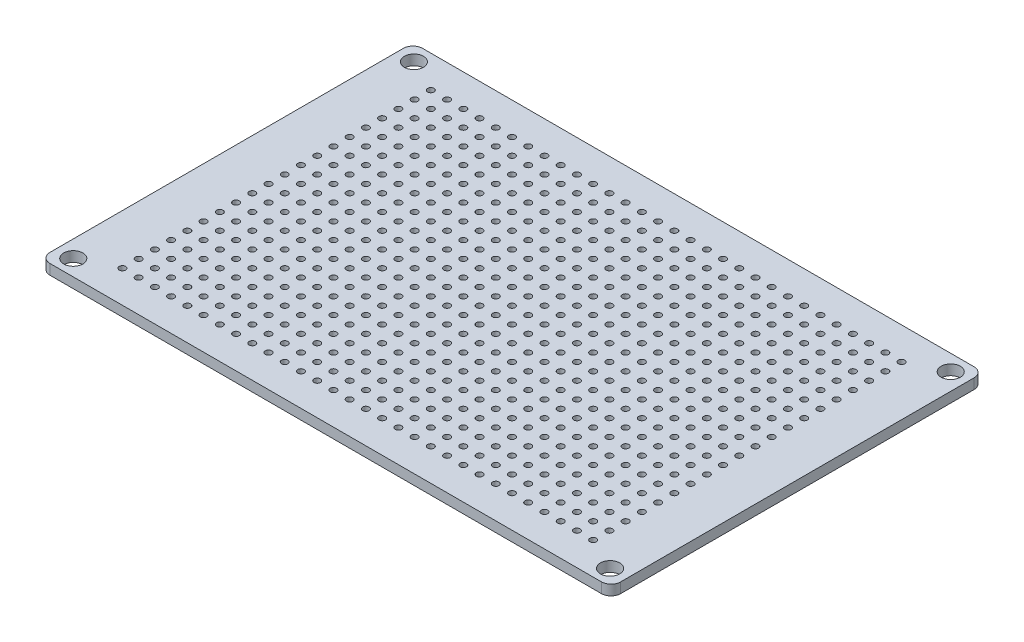
from build123d import *

# Parameters (mm, degrees)
SKETCH1_R           = 0.5
SKETCH1_R_2         = 1.5
BOSS_EXTRUDE1_DEPTH = 1.6


with BuildPart() as part:
    # Sketch1 → Boss-Extrude1 (new body)
    with BuildSketch(Plane(origin=(0, 0, 0), x_dir=(1, 0, 0), z_dir=(0, 1, 0))):
        with BuildLine():
            Line((1.5, 0), (87.8, 0))
            ThreePointArc((87.8, 0), (88.860660172, -0.439339828), (89.3, -1.5))
            Line((89.3, -1.5), (89.3, -56.8))
            ThreePointArc((89.3, -56.8), (88.860660172, -57.860660172), (87.8, -58.3))
            Line((87.8, -58.3), (1.5, -58.3))
            ThreePointArc((1.5, -58.3), (0.439339828, -57.860660172), (0, -56.8))
            Line((0, -56.8), (0, -1.5))
            ThreePointArc((0, -1.5), (0.439339828, -0.439339828), (1.5, 0))
        make_face()
        with Locations((7.82, -5.02)):
            Circle(SKETCH1_R, mode=Mode.SUBTRACT)
        with Locations((10.36, -5.02)):
            Circle(SKETCH1_R, mode=Mode.SUBTRACT)
        with Locations((12.9, -5.02)):
            Circle(SKETCH1_R, mode=Mode.SUBTRACT)
        with Locations((15.44, -5.02)):
            Circle(SKETCH1_R, mode=Mode.SUBTRACT)
        with Locations((17.98, -5.02)):
            Circle(SKETCH1_R, mode=Mode.SUBTRACT)
        with Locations((20.52, -5.02)):
            Circle(SKETCH1_R, mode=Mode.SUBTRACT)
        with Locations((23.06, -5.02)):
            Circle(SKETCH1_R, mode=Mode.SUBTRACT)
        with Locations((25.6, -5.02)):
            Circle(SKETCH1_R, mode=Mode.SUBTRACT)
        with Locations((28.14, -5.02)):
            Circle(SKETCH1_R, mode=Mode.SUBTRACT)
        with Locations((30.68, -5.02)):
            Circle(SKETCH1_R, mode=Mode.SUBTRACT)
        with Locations((33.22, -5.02)):
            Circle(SKETCH1_R, mode=Mode.SUBTRACT)
        with Locations((35.76, -5.02)):
            Circle(SKETCH1_R, mode=Mode.SUBTRACT)
        with Locations((38.3, -5.02)):
            Circle(SKETCH1_R, mode=Mode.SUBTRACT)
        with Locations((40.84, -5.02)):
            Circle(SKETCH1_R, mode=Mode.SUBTRACT)
        with Locations((43.38, -5.02)):
            Circle(SKETCH1_R, mode=Mode.SUBTRACT)
        with Locations((45.92, -5.02)):
            Circle(SKETCH1_R, mode=Mode.SUBTRACT)
        with Locations((48.46, -5.02)):
            Circle(SKETCH1_R, mode=Mode.SUBTRACT)
        with Locations((51, -5.02)):
            Circle(SKETCH1_R, mode=Mode.SUBTRACT)
        with Locations((53.54, -5.02)):
            Circle(SKETCH1_R, mode=Mode.SUBTRACT)
        with Locations((56.08, -5.02)):
            Circle(SKETCH1_R, mode=Mode.SUBTRACT)
        with Locations((58.62, -5.02)):
            Circle(SKETCH1_R, mode=Mode.SUBTRACT)
        with Locations((61.16, -5.02)):
            Circle(SKETCH1_R, mode=Mode.SUBTRACT)
        with Locations((63.7, -5.02)):
            Circle(SKETCH1_R, mode=Mode.SUBTRACT)
        with Locations((66.24, -5.02)):
            Circle(SKETCH1_R, mode=Mode.SUBTRACT)
        with Locations((68.78, -5.02)):
            Circle(SKETCH1_R, mode=Mode.SUBTRACT)
        with Locations((71.32, -5.02)):
            Circle(SKETCH1_R, mode=Mode.SUBTRACT)
        with Locations((73.86, -5.02)):
            Circle(SKETCH1_R, mode=Mode.SUBTRACT)
        with Locations((76.4, -5.02)):
            Circle(SKETCH1_R, mode=Mode.SUBTRACT)
        with Locations((78.94, -5.02)):
            Circle(SKETCH1_R, mode=Mode.SUBTRACT)
        with Locations((81.48, -5.02)):
            Circle(SKETCH1_R, mode=Mode.SUBTRACT)
        with Locations((10.36, -7.56)):
            Circle(SKETCH1_R, mode=Mode.SUBTRACT)
        with Locations((12.9, -7.56)):
            Circle(SKETCH1_R, mode=Mode.SUBTRACT)
        with Locations((15.44, -7.56)):
            Circle(SKETCH1_R, mode=Mode.SUBTRACT)
        with Locations((17.98, -7.56)):
            Circle(SKETCH1_R, mode=Mode.SUBTRACT)
        with Locations((20.52, -7.56)):
            Circle(SKETCH1_R, mode=Mode.SUBTRACT)
        with Locations((23.06, -7.56)):
            Circle(SKETCH1_R, mode=Mode.SUBTRACT)
        with Locations((25.6, -7.56)):
            Circle(SKETCH1_R, mode=Mode.SUBTRACT)
        with Locations((28.14, -7.56)):
            Circle(SKETCH1_R, mode=Mode.SUBTRACT)
        with Locations((30.68, -7.56)):
            Circle(SKETCH1_R, mode=Mode.SUBTRACT)
        with Locations((33.22, -7.56)):
            Circle(SKETCH1_R, mode=Mode.SUBTRACT)
        with Locations((35.76, -7.56)):
            Circle(SKETCH1_R, mode=Mode.SUBTRACT)
        with Locations((38.3, -7.56)):
            Circle(SKETCH1_R, mode=Mode.SUBTRACT)
        with Locations((40.84, -7.56)):
            Circle(SKETCH1_R, mode=Mode.SUBTRACT)
        with Locations((43.38, -7.56)):
            Circle(SKETCH1_R, mode=Mode.SUBTRACT)
        with Locations((45.92, -7.56)):
            Circle(SKETCH1_R, mode=Mode.SUBTRACT)
        with Locations((48.46, -7.56)):
            Circle(SKETCH1_R, mode=Mode.SUBTRACT)
        with Locations((51, -7.56)):
            Circle(SKETCH1_R, mode=Mode.SUBTRACT)
        with Locations((53.54, -7.56)):
            Circle(SKETCH1_R, mode=Mode.SUBTRACT)
        with Locations((56.08, -7.56)):
            Circle(SKETCH1_R, mode=Mode.SUBTRACT)
        with Locations((58.62, -7.56)):
            Circle(SKETCH1_R, mode=Mode.SUBTRACT)
        with Locations((61.16, -7.56)):
            Circle(SKETCH1_R, mode=Mode.SUBTRACT)
        with Locations((63.7, -7.56)):
            Circle(SKETCH1_R, mode=Mode.SUBTRACT)
        with Locations((66.24, -7.56)):
            Circle(SKETCH1_R, mode=Mode.SUBTRACT)
        with Locations((68.78, -7.56)):
            Circle(SKETCH1_R, mode=Mode.SUBTRACT)
        with Locations((71.32, -7.56)):
            Circle(SKETCH1_R, mode=Mode.SUBTRACT)
        with Locations((73.86, -7.56)):
            Circle(SKETCH1_R, mode=Mode.SUBTRACT)
        with Locations((76.4, -7.56)):
            Circle(SKETCH1_R, mode=Mode.SUBTRACT)
        with Locations((78.94, -7.56)):
            Circle(SKETCH1_R, mode=Mode.SUBTRACT)
        with Locations((81.48, -7.56)):
            Circle(SKETCH1_R, mode=Mode.SUBTRACT)
        with Locations((10.36, -10.1)):
            Circle(SKETCH1_R, mode=Mode.SUBTRACT)
        with Locations((12.9, -10.1)):
            Circle(SKETCH1_R, mode=Mode.SUBTRACT)
        with Locations((15.44, -10.1)):
            Circle(SKETCH1_R, mode=Mode.SUBTRACT)
        with Locations((17.98, -10.1)):
            Circle(SKETCH1_R, mode=Mode.SUBTRACT)
        with Locations((20.52, -10.1)):
            Circle(SKETCH1_R, mode=Mode.SUBTRACT)
        with Locations((23.06, -10.1)):
            Circle(SKETCH1_R, mode=Mode.SUBTRACT)
        with Locations((25.6, -10.1)):
            Circle(SKETCH1_R, mode=Mode.SUBTRACT)
        with Locations((28.14, -10.1)):
            Circle(SKETCH1_R, mode=Mode.SUBTRACT)
        with Locations((30.68, -10.1)):
            Circle(SKETCH1_R, mode=Mode.SUBTRACT)
        with Locations((33.22, -10.1)):
            Circle(SKETCH1_R, mode=Mode.SUBTRACT)
        with Locations((35.76, -10.1)):
            Circle(SKETCH1_R, mode=Mode.SUBTRACT)
        with Locations((38.3, -10.1)):
            Circle(SKETCH1_R, mode=Mode.SUBTRACT)
        with Locations((40.84, -10.1)):
            Circle(SKETCH1_R, mode=Mode.SUBTRACT)
        with Locations((43.38, -10.1)):
            Circle(SKETCH1_R, mode=Mode.SUBTRACT)
        with Locations((45.92, -10.1)):
            Circle(SKETCH1_R, mode=Mode.SUBTRACT)
        with Locations((48.46, -10.1)):
            Circle(SKETCH1_R, mode=Mode.SUBTRACT)
        with Locations((51, -10.1)):
            Circle(SKETCH1_R, mode=Mode.SUBTRACT)
        with Locations((53.54, -10.1)):
            Circle(SKETCH1_R, mode=Mode.SUBTRACT)
        with Locations((56.08, -10.1)):
            Circle(SKETCH1_R, mode=Mode.SUBTRACT)
        with Locations((58.62, -10.1)):
            Circle(SKETCH1_R, mode=Mode.SUBTRACT)
        with Locations((61.16, -10.1)):
            Circle(SKETCH1_R, mode=Mode.SUBTRACT)
        with Locations((63.7, -10.1)):
            Circle(SKETCH1_R, mode=Mode.SUBTRACT)
        with Locations((66.24, -10.1)):
            Circle(SKETCH1_R, mode=Mode.SUBTRACT)
        with Locations((68.78, -10.1)):
            Circle(SKETCH1_R, mode=Mode.SUBTRACT)
        with Locations((71.32, -10.1)):
            Circle(SKETCH1_R, mode=Mode.SUBTRACT)
        with Locations((73.86, -10.1)):
            Circle(SKETCH1_R, mode=Mode.SUBTRACT)
        with Locations((76.4, -10.1)):
            Circle(SKETCH1_R, mode=Mode.SUBTRACT)
        with Locations((78.94, -10.1)):
            Circle(SKETCH1_R, mode=Mode.SUBTRACT)
        with Locations((81.48, -10.1)):
            Circle(SKETCH1_R, mode=Mode.SUBTRACT)
        with Locations((10.36, -12.64)):
            Circle(SKETCH1_R, mode=Mode.SUBTRACT)
        with Locations((12.9, -12.64)):
            Circle(SKETCH1_R, mode=Mode.SUBTRACT)
        with Locations((15.44, -12.64)):
            Circle(SKETCH1_R, mode=Mode.SUBTRACT)
        with Locations((17.98, -12.64)):
            Circle(SKETCH1_R, mode=Mode.SUBTRACT)
        with Locations((20.52, -12.64)):
            Circle(SKETCH1_R, mode=Mode.SUBTRACT)
        with Locations((23.06, -12.64)):
            Circle(SKETCH1_R, mode=Mode.SUBTRACT)
        with Locations((25.6, -12.64)):
            Circle(SKETCH1_R, mode=Mode.SUBTRACT)
        with Locations((28.14, -12.64)):
            Circle(SKETCH1_R, mode=Mode.SUBTRACT)
        with Locations((30.68, -12.64)):
            Circle(SKETCH1_R, mode=Mode.SUBTRACT)
        with Locations((33.22, -12.64)):
            Circle(SKETCH1_R, mode=Mode.SUBTRACT)
        with Locations((35.76, -12.64)):
            Circle(SKETCH1_R, mode=Mode.SUBTRACT)
        with Locations((38.3, -12.64)):
            Circle(SKETCH1_R, mode=Mode.SUBTRACT)
        with Locations((40.84, -12.64)):
            Circle(SKETCH1_R, mode=Mode.SUBTRACT)
        with Locations((43.38, -12.64)):
            Circle(SKETCH1_R, mode=Mode.SUBTRACT)
        with Locations((45.92, -12.64)):
            Circle(SKETCH1_R, mode=Mode.SUBTRACT)
        with Locations((48.46, -12.64)):
            Circle(SKETCH1_R, mode=Mode.SUBTRACT)
        with Locations((51, -12.64)):
            Circle(SKETCH1_R, mode=Mode.SUBTRACT)
        with Locations((53.54, -12.64)):
            Circle(SKETCH1_R, mode=Mode.SUBTRACT)
        with Locations((56.08, -12.64)):
            Circle(SKETCH1_R, mode=Mode.SUBTRACT)
        with Locations((58.62, -12.64)):
            Circle(SKETCH1_R, mode=Mode.SUBTRACT)
        with Locations((61.16, -12.64)):
            Circle(SKETCH1_R, mode=Mode.SUBTRACT)
        with Locations((63.7, -12.64)):
            Circle(SKETCH1_R, mode=Mode.SUBTRACT)
        with Locations((66.24, -12.64)):
            Circle(SKETCH1_R, mode=Mode.SUBTRACT)
        with Locations((68.78, -12.64)):
            Circle(SKETCH1_R, mode=Mode.SUBTRACT)
        with Locations((71.32, -12.64)):
            Circle(SKETCH1_R, mode=Mode.SUBTRACT)
        with Locations((73.86, -12.64)):
            Circle(SKETCH1_R, mode=Mode.SUBTRACT)
        with Locations((76.4, -12.64)):
            Circle(SKETCH1_R, mode=Mode.SUBTRACT)
        with Locations((78.94, -12.64)):
            Circle(SKETCH1_R, mode=Mode.SUBTRACT)
        with Locations((81.48, -12.64)):
            Circle(SKETCH1_R, mode=Mode.SUBTRACT)
        with Locations((10.36, -15.18)):
            Circle(SKETCH1_R, mode=Mode.SUBTRACT)
        with Locations((12.9, -15.18)):
            Circle(SKETCH1_R, mode=Mode.SUBTRACT)
        with Locations((15.44, -15.18)):
            Circle(SKETCH1_R, mode=Mode.SUBTRACT)
        with Locations((17.98, -15.18)):
            Circle(SKETCH1_R, mode=Mode.SUBTRACT)
        with Locations((20.52, -15.18)):
            Circle(SKETCH1_R, mode=Mode.SUBTRACT)
        with Locations((23.06, -15.18)):
            Circle(SKETCH1_R, mode=Mode.SUBTRACT)
        with Locations((25.6, -15.18)):
            Circle(SKETCH1_R, mode=Mode.SUBTRACT)
        with Locations((28.14, -15.18)):
            Circle(SKETCH1_R, mode=Mode.SUBTRACT)
        with Locations((30.68, -15.18)):
            Circle(SKETCH1_R, mode=Mode.SUBTRACT)
        with Locations((33.22, -15.18)):
            Circle(SKETCH1_R, mode=Mode.SUBTRACT)
        with Locations((35.76, -15.18)):
            Circle(SKETCH1_R, mode=Mode.SUBTRACT)
        with Locations((38.3, -15.18)):
            Circle(SKETCH1_R, mode=Mode.SUBTRACT)
        with Locations((40.84, -15.18)):
            Circle(SKETCH1_R, mode=Mode.SUBTRACT)
        with Locations((43.38, -15.18)):
            Circle(SKETCH1_R, mode=Mode.SUBTRACT)
        with Locations((45.92, -15.18)):
            Circle(SKETCH1_R, mode=Mode.SUBTRACT)
        with Locations((48.46, -15.18)):
            Circle(SKETCH1_R, mode=Mode.SUBTRACT)
        with Locations((51, -15.18)):
            Circle(SKETCH1_R, mode=Mode.SUBTRACT)
        with Locations((53.54, -15.18)):
            Circle(SKETCH1_R, mode=Mode.SUBTRACT)
        with Locations((56.08, -15.18)):
            Circle(SKETCH1_R, mode=Mode.SUBTRACT)
        with Locations((58.62, -15.18)):
            Circle(SKETCH1_R, mode=Mode.SUBTRACT)
        with Locations((61.16, -15.18)):
            Circle(SKETCH1_R, mode=Mode.SUBTRACT)
        with Locations((63.7, -15.18)):
            Circle(SKETCH1_R, mode=Mode.SUBTRACT)
        with Locations((66.24, -15.18)):
            Circle(SKETCH1_R, mode=Mode.SUBTRACT)
        with Locations((68.78, -15.18)):
            Circle(SKETCH1_R, mode=Mode.SUBTRACT)
        with Locations((71.32, -15.18)):
            Circle(SKETCH1_R, mode=Mode.SUBTRACT)
        with Locations((73.86, -15.18)):
            Circle(SKETCH1_R, mode=Mode.SUBTRACT)
        with Locations((76.4, -15.18)):
            Circle(SKETCH1_R, mode=Mode.SUBTRACT)
        with Locations((78.94, -15.18)):
            Circle(SKETCH1_R, mode=Mode.SUBTRACT)
        with Locations((81.48, -15.18)):
            Circle(SKETCH1_R, mode=Mode.SUBTRACT)
        with Locations((10.36, -17.72)):
            Circle(SKETCH1_R, mode=Mode.SUBTRACT)
        with Locations((12.9, -17.72)):
            Circle(SKETCH1_R, mode=Mode.SUBTRACT)
        with Locations((15.44, -17.72)):
            Circle(SKETCH1_R, mode=Mode.SUBTRACT)
        with Locations((17.98, -17.72)):
            Circle(SKETCH1_R, mode=Mode.SUBTRACT)
        with Locations((20.52, -17.72)):
            Circle(SKETCH1_R, mode=Mode.SUBTRACT)
        with Locations((23.06, -17.72)):
            Circle(SKETCH1_R, mode=Mode.SUBTRACT)
        with Locations((25.6, -17.72)):
            Circle(SKETCH1_R, mode=Mode.SUBTRACT)
        with Locations((28.14, -17.72)):
            Circle(SKETCH1_R, mode=Mode.SUBTRACT)
        with Locations((30.68, -17.72)):
            Circle(SKETCH1_R, mode=Mode.SUBTRACT)
        with Locations((33.22, -17.72)):
            Circle(SKETCH1_R, mode=Mode.SUBTRACT)
        with Locations((35.76, -17.72)):
            Circle(SKETCH1_R, mode=Mode.SUBTRACT)
        with Locations((38.3, -17.72)):
            Circle(SKETCH1_R, mode=Mode.SUBTRACT)
        with Locations((40.84, -17.72)):
            Circle(SKETCH1_R, mode=Mode.SUBTRACT)
        with Locations((43.38, -17.72)):
            Circle(SKETCH1_R, mode=Mode.SUBTRACT)
        with Locations((45.92, -17.72)):
            Circle(SKETCH1_R, mode=Mode.SUBTRACT)
        with Locations((48.46, -17.72)):
            Circle(SKETCH1_R, mode=Mode.SUBTRACT)
        with Locations((51, -17.72)):
            Circle(SKETCH1_R, mode=Mode.SUBTRACT)
        with Locations((53.54, -17.72)):
            Circle(SKETCH1_R, mode=Mode.SUBTRACT)
        with Locations((56.08, -17.72)):
            Circle(SKETCH1_R, mode=Mode.SUBTRACT)
        with Locations((58.62, -17.72)):
            Circle(SKETCH1_R, mode=Mode.SUBTRACT)
        with Locations((61.16, -17.72)):
            Circle(SKETCH1_R, mode=Mode.SUBTRACT)
        with Locations((63.7, -17.72)):
            Circle(SKETCH1_R, mode=Mode.SUBTRACT)
        with Locations((66.24, -17.72)):
            Circle(SKETCH1_R, mode=Mode.SUBTRACT)
        with Locations((68.78, -17.72)):
            Circle(SKETCH1_R, mode=Mode.SUBTRACT)
        with Locations((71.32, -17.72)):
            Circle(SKETCH1_R, mode=Mode.SUBTRACT)
        with Locations((73.86, -17.72)):
            Circle(SKETCH1_R, mode=Mode.SUBTRACT)
        with Locations((76.4, -17.72)):
            Circle(SKETCH1_R, mode=Mode.SUBTRACT)
        with Locations((78.94, -17.72)):
            Circle(SKETCH1_R, mode=Mode.SUBTRACT)
        with Locations((81.48, -17.72)):
            Circle(SKETCH1_R, mode=Mode.SUBTRACT)
        with Locations((10.36, -20.26)):
            Circle(SKETCH1_R, mode=Mode.SUBTRACT)
        with Locations((12.9, -20.26)):
            Circle(SKETCH1_R, mode=Mode.SUBTRACT)
        with Locations((15.44, -20.26)):
            Circle(SKETCH1_R, mode=Mode.SUBTRACT)
        with Locations((17.98, -20.26)):
            Circle(SKETCH1_R, mode=Mode.SUBTRACT)
        with Locations((20.52, -20.26)):
            Circle(SKETCH1_R, mode=Mode.SUBTRACT)
        with Locations((23.06, -20.26)):
            Circle(SKETCH1_R, mode=Mode.SUBTRACT)
        with Locations((25.6, -20.26)):
            Circle(SKETCH1_R, mode=Mode.SUBTRACT)
        with Locations((28.14, -20.26)):
            Circle(SKETCH1_R, mode=Mode.SUBTRACT)
        with Locations((30.68, -20.26)):
            Circle(SKETCH1_R, mode=Mode.SUBTRACT)
        with Locations((33.22, -20.26)):
            Circle(SKETCH1_R, mode=Mode.SUBTRACT)
        with Locations((35.76, -20.26)):
            Circle(SKETCH1_R, mode=Mode.SUBTRACT)
        with Locations((38.3, -20.26)):
            Circle(SKETCH1_R, mode=Mode.SUBTRACT)
        with Locations((40.84, -20.26)):
            Circle(SKETCH1_R, mode=Mode.SUBTRACT)
        with Locations((43.38, -20.26)):
            Circle(SKETCH1_R, mode=Mode.SUBTRACT)
        with Locations((45.92, -20.26)):
            Circle(SKETCH1_R, mode=Mode.SUBTRACT)
        with Locations((48.46, -20.26)):
            Circle(SKETCH1_R, mode=Mode.SUBTRACT)
        with Locations((51, -20.26)):
            Circle(SKETCH1_R, mode=Mode.SUBTRACT)
        with Locations((53.54, -20.26)):
            Circle(SKETCH1_R, mode=Mode.SUBTRACT)
        with Locations((56.08, -20.26)):
            Circle(SKETCH1_R, mode=Mode.SUBTRACT)
        with Locations((58.62, -20.26)):
            Circle(SKETCH1_R, mode=Mode.SUBTRACT)
        with Locations((61.16, -20.26)):
            Circle(SKETCH1_R, mode=Mode.SUBTRACT)
        with Locations((63.7, -20.26)):
            Circle(SKETCH1_R, mode=Mode.SUBTRACT)
        with Locations((66.24, -20.26)):
            Circle(SKETCH1_R, mode=Mode.SUBTRACT)
        with Locations((68.78, -20.26)):
            Circle(SKETCH1_R, mode=Mode.SUBTRACT)
        with Locations((71.32, -20.26)):
            Circle(SKETCH1_R, mode=Mode.SUBTRACT)
        with Locations((73.86, -20.26)):
            Circle(SKETCH1_R, mode=Mode.SUBTRACT)
        with Locations((76.4, -20.26)):
            Circle(SKETCH1_R, mode=Mode.SUBTRACT)
        with Locations((78.94, -20.26)):
            Circle(SKETCH1_R, mode=Mode.SUBTRACT)
        with Locations((81.48, -20.26)):
            Circle(SKETCH1_R, mode=Mode.SUBTRACT)
        with Locations((10.36, -22.8)):
            Circle(SKETCH1_R, mode=Mode.SUBTRACT)
        with Locations((12.9, -22.8)):
            Circle(SKETCH1_R, mode=Mode.SUBTRACT)
        with Locations((15.44, -22.8)):
            Circle(SKETCH1_R, mode=Mode.SUBTRACT)
        with Locations((17.98, -22.8)):
            Circle(SKETCH1_R, mode=Mode.SUBTRACT)
        with Locations((20.52, -22.8)):
            Circle(SKETCH1_R, mode=Mode.SUBTRACT)
        with Locations((23.06, -22.8)):
            Circle(SKETCH1_R, mode=Mode.SUBTRACT)
        with Locations((25.6, -22.8)):
            Circle(SKETCH1_R, mode=Mode.SUBTRACT)
        with Locations((28.14, -22.8)):
            Circle(SKETCH1_R, mode=Mode.SUBTRACT)
        with Locations((30.68, -22.8)):
            Circle(SKETCH1_R, mode=Mode.SUBTRACT)
        with Locations((33.22, -22.8)):
            Circle(SKETCH1_R, mode=Mode.SUBTRACT)
        with Locations((35.76, -22.8)):
            Circle(SKETCH1_R, mode=Mode.SUBTRACT)
        with Locations((38.3, -22.8)):
            Circle(SKETCH1_R, mode=Mode.SUBTRACT)
        with Locations((40.84, -22.8)):
            Circle(SKETCH1_R, mode=Mode.SUBTRACT)
        with Locations((43.38, -22.8)):
            Circle(SKETCH1_R, mode=Mode.SUBTRACT)
        with Locations((45.92, -22.8)):
            Circle(SKETCH1_R, mode=Mode.SUBTRACT)
        with Locations((48.46, -22.8)):
            Circle(SKETCH1_R, mode=Mode.SUBTRACT)
        with Locations((51, -22.8)):
            Circle(SKETCH1_R, mode=Mode.SUBTRACT)
        with Locations((53.54, -22.8)):
            Circle(SKETCH1_R, mode=Mode.SUBTRACT)
        with Locations((56.08, -22.8)):
            Circle(SKETCH1_R, mode=Mode.SUBTRACT)
        with Locations((58.62, -22.8)):
            Circle(SKETCH1_R, mode=Mode.SUBTRACT)
        with Locations((61.16, -22.8)):
            Circle(SKETCH1_R, mode=Mode.SUBTRACT)
        with Locations((63.7, -22.8)):
            Circle(SKETCH1_R, mode=Mode.SUBTRACT)
        with Locations((66.24, -22.8)):
            Circle(SKETCH1_R, mode=Mode.SUBTRACT)
        with Locations((68.78, -22.8)):
            Circle(SKETCH1_R, mode=Mode.SUBTRACT)
        with Locations((71.32, -22.8)):
            Circle(SKETCH1_R, mode=Mode.SUBTRACT)
        with Locations((73.86, -22.8)):
            Circle(SKETCH1_R, mode=Mode.SUBTRACT)
        with Locations((76.4, -22.8)):
            Circle(SKETCH1_R, mode=Mode.SUBTRACT)
        with Locations((78.94, -22.8)):
            Circle(SKETCH1_R, mode=Mode.SUBTRACT)
        with Locations((81.48, -22.8)):
            Circle(SKETCH1_R, mode=Mode.SUBTRACT)
        with Locations((10.36, -25.34)):
            Circle(SKETCH1_R, mode=Mode.SUBTRACT)
        with Locations((12.9, -25.34)):
            Circle(SKETCH1_R, mode=Mode.SUBTRACT)
        with Locations((15.44, -25.34)):
            Circle(SKETCH1_R, mode=Mode.SUBTRACT)
        with Locations((17.98, -25.34)):
            Circle(SKETCH1_R, mode=Mode.SUBTRACT)
        with Locations((20.52, -25.34)):
            Circle(SKETCH1_R, mode=Mode.SUBTRACT)
        with Locations((23.06, -25.34)):
            Circle(SKETCH1_R, mode=Mode.SUBTRACT)
        with Locations((25.6, -25.34)):
            Circle(SKETCH1_R, mode=Mode.SUBTRACT)
        with Locations((28.14, -25.34)):
            Circle(SKETCH1_R, mode=Mode.SUBTRACT)
        with Locations((30.68, -25.34)):
            Circle(SKETCH1_R, mode=Mode.SUBTRACT)
        with Locations((33.22, -25.34)):
            Circle(SKETCH1_R, mode=Mode.SUBTRACT)
        with Locations((35.76, -25.34)):
            Circle(SKETCH1_R, mode=Mode.SUBTRACT)
        with Locations((38.3, -25.34)):
            Circle(SKETCH1_R, mode=Mode.SUBTRACT)
        with Locations((40.84, -25.34)):
            Circle(SKETCH1_R, mode=Mode.SUBTRACT)
        with Locations((43.38, -25.34)):
            Circle(SKETCH1_R, mode=Mode.SUBTRACT)
        with Locations((45.92, -25.34)):
            Circle(SKETCH1_R, mode=Mode.SUBTRACT)
        with Locations((48.46, -25.34)):
            Circle(SKETCH1_R, mode=Mode.SUBTRACT)
        with Locations((51, -25.34)):
            Circle(SKETCH1_R, mode=Mode.SUBTRACT)
        with Locations((53.54, -25.34)):
            Circle(SKETCH1_R, mode=Mode.SUBTRACT)
        with Locations((56.08, -25.34)):
            Circle(SKETCH1_R, mode=Mode.SUBTRACT)
        with Locations((58.62, -25.34)):
            Circle(SKETCH1_R, mode=Mode.SUBTRACT)
        with Locations((61.16, -25.34)):
            Circle(SKETCH1_R, mode=Mode.SUBTRACT)
        with Locations((63.7, -25.34)):
            Circle(SKETCH1_R, mode=Mode.SUBTRACT)
        with Locations((66.24, -25.34)):
            Circle(SKETCH1_R, mode=Mode.SUBTRACT)
        with Locations((68.78, -25.34)):
            Circle(SKETCH1_R, mode=Mode.SUBTRACT)
        with Locations((71.32, -25.34)):
            Circle(SKETCH1_R, mode=Mode.SUBTRACT)
        with Locations((73.86, -25.34)):
            Circle(SKETCH1_R, mode=Mode.SUBTRACT)
        with Locations((76.4, -25.34)):
            Circle(SKETCH1_R, mode=Mode.SUBTRACT)
        with Locations((78.94, -25.34)):
            Circle(SKETCH1_R, mode=Mode.SUBTRACT)
        with Locations((81.48, -25.34)):
            Circle(SKETCH1_R, mode=Mode.SUBTRACT)
        with Locations((10.36, -27.88)):
            Circle(SKETCH1_R, mode=Mode.SUBTRACT)
        with Locations((12.9, -27.88)):
            Circle(SKETCH1_R, mode=Mode.SUBTRACT)
        with Locations((15.44, -27.88)):
            Circle(SKETCH1_R, mode=Mode.SUBTRACT)
        with Locations((17.98, -27.88)):
            Circle(SKETCH1_R, mode=Mode.SUBTRACT)
        with Locations((20.52, -27.88)):
            Circle(SKETCH1_R, mode=Mode.SUBTRACT)
        with Locations((23.06, -27.88)):
            Circle(SKETCH1_R, mode=Mode.SUBTRACT)
        with Locations((25.6, -27.88)):
            Circle(SKETCH1_R, mode=Mode.SUBTRACT)
        with Locations((28.14, -27.88)):
            Circle(SKETCH1_R, mode=Mode.SUBTRACT)
        with Locations((30.68, -27.88)):
            Circle(SKETCH1_R, mode=Mode.SUBTRACT)
        with Locations((33.22, -27.88)):
            Circle(SKETCH1_R, mode=Mode.SUBTRACT)
        with Locations((35.76, -27.88)):
            Circle(SKETCH1_R, mode=Mode.SUBTRACT)
        with Locations((38.3, -27.88)):
            Circle(SKETCH1_R, mode=Mode.SUBTRACT)
        with Locations((40.84, -27.88)):
            Circle(SKETCH1_R, mode=Mode.SUBTRACT)
        with Locations((43.38, -27.88)):
            Circle(SKETCH1_R, mode=Mode.SUBTRACT)
        with Locations((45.92, -27.88)):
            Circle(SKETCH1_R, mode=Mode.SUBTRACT)
        with Locations((48.46, -27.88)):
            Circle(SKETCH1_R, mode=Mode.SUBTRACT)
        with Locations((51, -27.88)):
            Circle(SKETCH1_R, mode=Mode.SUBTRACT)
        with Locations((53.54, -27.88)):
            Circle(SKETCH1_R, mode=Mode.SUBTRACT)
        with Locations((56.08, -27.88)):
            Circle(SKETCH1_R, mode=Mode.SUBTRACT)
        with Locations((58.62, -27.88)):
            Circle(SKETCH1_R, mode=Mode.SUBTRACT)
        with Locations((61.16, -27.88)):
            Circle(SKETCH1_R, mode=Mode.SUBTRACT)
        with Locations((63.7, -27.88)):
            Circle(SKETCH1_R, mode=Mode.SUBTRACT)
        with Locations((66.24, -27.88)):
            Circle(SKETCH1_R, mode=Mode.SUBTRACT)
        with Locations((68.78, -27.88)):
            Circle(SKETCH1_R, mode=Mode.SUBTRACT)
        with Locations((71.32, -27.88)):
            Circle(SKETCH1_R, mode=Mode.SUBTRACT)
        with Locations((73.86, -27.88)):
            Circle(SKETCH1_R, mode=Mode.SUBTRACT)
        with Locations((76.4, -27.88)):
            Circle(SKETCH1_R, mode=Mode.SUBTRACT)
        with Locations((78.94, -27.88)):
            Circle(SKETCH1_R, mode=Mode.SUBTRACT)
        with Locations((81.48, -27.88)):
            Circle(SKETCH1_R, mode=Mode.SUBTRACT)
        with Locations((10.36, -30.42)):
            Circle(SKETCH1_R, mode=Mode.SUBTRACT)
        with Locations((12.9, -30.42)):
            Circle(SKETCH1_R, mode=Mode.SUBTRACT)
        with Locations((15.44, -30.42)):
            Circle(SKETCH1_R, mode=Mode.SUBTRACT)
        with Locations((17.98, -30.42)):
            Circle(SKETCH1_R, mode=Mode.SUBTRACT)
        with Locations((20.52, -30.42)):
            Circle(SKETCH1_R, mode=Mode.SUBTRACT)
        with Locations((23.06, -30.42)):
            Circle(SKETCH1_R, mode=Mode.SUBTRACT)
        with Locations((25.6, -30.42)):
            Circle(SKETCH1_R, mode=Mode.SUBTRACT)
        with Locations((28.14, -30.42)):
            Circle(SKETCH1_R, mode=Mode.SUBTRACT)
        with Locations((30.68, -30.42)):
            Circle(SKETCH1_R, mode=Mode.SUBTRACT)
        with Locations((33.22, -30.42)):
            Circle(SKETCH1_R, mode=Mode.SUBTRACT)
        with Locations((35.76, -30.42)):
            Circle(SKETCH1_R, mode=Mode.SUBTRACT)
        with Locations((38.3, -30.42)):
            Circle(SKETCH1_R, mode=Mode.SUBTRACT)
        with Locations((40.84, -30.42)):
            Circle(SKETCH1_R, mode=Mode.SUBTRACT)
        with Locations((43.38, -30.42)):
            Circle(SKETCH1_R, mode=Mode.SUBTRACT)
        with Locations((45.92, -30.42)):
            Circle(SKETCH1_R, mode=Mode.SUBTRACT)
        with Locations((48.46, -30.42)):
            Circle(SKETCH1_R, mode=Mode.SUBTRACT)
        with Locations((51, -30.42)):
            Circle(SKETCH1_R, mode=Mode.SUBTRACT)
        with Locations((53.54, -30.42)):
            Circle(SKETCH1_R, mode=Mode.SUBTRACT)
        with Locations((56.08, -30.42)):
            Circle(SKETCH1_R, mode=Mode.SUBTRACT)
        with Locations((58.62, -30.42)):
            Circle(SKETCH1_R, mode=Mode.SUBTRACT)
        with Locations((61.16, -30.42)):
            Circle(SKETCH1_R, mode=Mode.SUBTRACT)
        with Locations((63.7, -30.42)):
            Circle(SKETCH1_R, mode=Mode.SUBTRACT)
        with Locations((66.24, -30.42)):
            Circle(SKETCH1_R, mode=Mode.SUBTRACT)
        with Locations((68.78, -30.42)):
            Circle(SKETCH1_R, mode=Mode.SUBTRACT)
        with Locations((71.32, -30.42)):
            Circle(SKETCH1_R, mode=Mode.SUBTRACT)
        with Locations((73.86, -30.42)):
            Circle(SKETCH1_R, mode=Mode.SUBTRACT)
        with Locations((76.4, -30.42)):
            Circle(SKETCH1_R, mode=Mode.SUBTRACT)
        with Locations((78.94, -30.42)):
            Circle(SKETCH1_R, mode=Mode.SUBTRACT)
        with Locations((81.48, -30.42)):
            Circle(SKETCH1_R, mode=Mode.SUBTRACT)
        with Locations((10.36, -32.96)):
            Circle(SKETCH1_R, mode=Mode.SUBTRACT)
        with Locations((12.9, -32.96)):
            Circle(SKETCH1_R, mode=Mode.SUBTRACT)
        with Locations((15.44, -32.96)):
            Circle(SKETCH1_R, mode=Mode.SUBTRACT)
        with Locations((17.98, -32.96)):
            Circle(SKETCH1_R, mode=Mode.SUBTRACT)
        with Locations((20.52, -32.96)):
            Circle(SKETCH1_R, mode=Mode.SUBTRACT)
        with Locations((23.06, -32.96)):
            Circle(SKETCH1_R, mode=Mode.SUBTRACT)
        with Locations((25.6, -32.96)):
            Circle(SKETCH1_R, mode=Mode.SUBTRACT)
        with Locations((28.14, -32.96)):
            Circle(SKETCH1_R, mode=Mode.SUBTRACT)
        with Locations((30.68, -32.96)):
            Circle(SKETCH1_R, mode=Mode.SUBTRACT)
        with Locations((33.22, -32.96)):
            Circle(SKETCH1_R, mode=Mode.SUBTRACT)
        with Locations((35.76, -32.96)):
            Circle(SKETCH1_R, mode=Mode.SUBTRACT)
        with Locations((38.3, -32.96)):
            Circle(SKETCH1_R, mode=Mode.SUBTRACT)
        with Locations((40.84, -32.96)):
            Circle(SKETCH1_R, mode=Mode.SUBTRACT)
        with Locations((43.38, -32.96)):
            Circle(SKETCH1_R, mode=Mode.SUBTRACT)
        with Locations((45.92, -32.96)):
            Circle(SKETCH1_R, mode=Mode.SUBTRACT)
        with Locations((48.46, -32.96)):
            Circle(SKETCH1_R, mode=Mode.SUBTRACT)
        with Locations((51, -32.96)):
            Circle(SKETCH1_R, mode=Mode.SUBTRACT)
        with Locations((53.54, -32.96)):
            Circle(SKETCH1_R, mode=Mode.SUBTRACT)
        with Locations((56.08, -32.96)):
            Circle(SKETCH1_R, mode=Mode.SUBTRACT)
        with Locations((58.62, -32.96)):
            Circle(SKETCH1_R, mode=Mode.SUBTRACT)
        with Locations((61.16, -32.96)):
            Circle(SKETCH1_R, mode=Mode.SUBTRACT)
        with Locations((63.7, -32.96)):
            Circle(SKETCH1_R, mode=Mode.SUBTRACT)
        with Locations((66.24, -32.96)):
            Circle(SKETCH1_R, mode=Mode.SUBTRACT)
        with Locations((68.78, -32.96)):
            Circle(SKETCH1_R, mode=Mode.SUBTRACT)
        with Locations((71.32, -32.96)):
            Circle(SKETCH1_R, mode=Mode.SUBTRACT)
        with Locations((73.86, -32.96)):
            Circle(SKETCH1_R, mode=Mode.SUBTRACT)
        with Locations((76.4, -32.96)):
            Circle(SKETCH1_R, mode=Mode.SUBTRACT)
        with Locations((78.94, -32.96)):
            Circle(SKETCH1_R, mode=Mode.SUBTRACT)
        with Locations((81.48, -32.96)):
            Circle(SKETCH1_R, mode=Mode.SUBTRACT)
        with Locations((10.36, -35.5)):
            Circle(SKETCH1_R, mode=Mode.SUBTRACT)
        with Locations((12.9, -35.5)):
            Circle(SKETCH1_R, mode=Mode.SUBTRACT)
        with Locations((15.44, -35.5)):
            Circle(SKETCH1_R, mode=Mode.SUBTRACT)
        with Locations((17.98, -35.5)):
            Circle(SKETCH1_R, mode=Mode.SUBTRACT)
        with Locations((20.52, -35.5)):
            Circle(SKETCH1_R, mode=Mode.SUBTRACT)
        with Locations((23.06, -35.5)):
            Circle(SKETCH1_R, mode=Mode.SUBTRACT)
        with Locations((25.6, -35.5)):
            Circle(SKETCH1_R, mode=Mode.SUBTRACT)
        with Locations((28.14, -35.5)):
            Circle(SKETCH1_R, mode=Mode.SUBTRACT)
        with Locations((30.68, -35.5)):
            Circle(SKETCH1_R, mode=Mode.SUBTRACT)
        with Locations((33.22, -35.5)):
            Circle(SKETCH1_R, mode=Mode.SUBTRACT)
        with Locations((35.76, -35.5)):
            Circle(SKETCH1_R, mode=Mode.SUBTRACT)
        with Locations((38.3, -35.5)):
            Circle(SKETCH1_R, mode=Mode.SUBTRACT)
        with Locations((40.84, -35.5)):
            Circle(SKETCH1_R, mode=Mode.SUBTRACT)
        with Locations((43.38, -35.5)):
            Circle(SKETCH1_R, mode=Mode.SUBTRACT)
        with Locations((45.92, -35.5)):
            Circle(SKETCH1_R, mode=Mode.SUBTRACT)
        with Locations((48.46, -35.5)):
            Circle(SKETCH1_R, mode=Mode.SUBTRACT)
        with Locations((51, -35.5)):
            Circle(SKETCH1_R, mode=Mode.SUBTRACT)
        with Locations((53.54, -35.5)):
            Circle(SKETCH1_R, mode=Mode.SUBTRACT)
        with Locations((56.08, -35.5)):
            Circle(SKETCH1_R, mode=Mode.SUBTRACT)
        with Locations((58.62, -35.5)):
            Circle(SKETCH1_R, mode=Mode.SUBTRACT)
        with Locations((61.16, -35.5)):
            Circle(SKETCH1_R, mode=Mode.SUBTRACT)
        with Locations((63.7, -35.5)):
            Circle(SKETCH1_R, mode=Mode.SUBTRACT)
        with Locations((66.24, -35.5)):
            Circle(SKETCH1_R, mode=Mode.SUBTRACT)
        with Locations((68.78, -35.5)):
            Circle(SKETCH1_R, mode=Mode.SUBTRACT)
        with Locations((71.32, -35.5)):
            Circle(SKETCH1_R, mode=Mode.SUBTRACT)
        with Locations((73.86, -35.5)):
            Circle(SKETCH1_R, mode=Mode.SUBTRACT)
        with Locations((76.4, -35.5)):
            Circle(SKETCH1_R, mode=Mode.SUBTRACT)
        with Locations((78.94, -35.5)):
            Circle(SKETCH1_R, mode=Mode.SUBTRACT)
        with Locations((81.48, -35.5)):
            Circle(SKETCH1_R, mode=Mode.SUBTRACT)
        with Locations((10.36, -38.04)):
            Circle(SKETCH1_R, mode=Mode.SUBTRACT)
        with Locations((12.9, -38.04)):
            Circle(SKETCH1_R, mode=Mode.SUBTRACT)
        with Locations((15.44, -38.04)):
            Circle(SKETCH1_R, mode=Mode.SUBTRACT)
        with Locations((17.98, -38.04)):
            Circle(SKETCH1_R, mode=Mode.SUBTRACT)
        with Locations((20.52, -38.04)):
            Circle(SKETCH1_R, mode=Mode.SUBTRACT)
        with Locations((23.06, -38.04)):
            Circle(SKETCH1_R, mode=Mode.SUBTRACT)
        with Locations((25.6, -38.04)):
            Circle(SKETCH1_R, mode=Mode.SUBTRACT)
        with Locations((28.14, -38.04)):
            Circle(SKETCH1_R, mode=Mode.SUBTRACT)
        with Locations((30.68, -38.04)):
            Circle(SKETCH1_R, mode=Mode.SUBTRACT)
        with Locations((33.22, -38.04)):
            Circle(SKETCH1_R, mode=Mode.SUBTRACT)
        with Locations((35.76, -38.04)):
            Circle(SKETCH1_R, mode=Mode.SUBTRACT)
        with Locations((38.3, -38.04)):
            Circle(SKETCH1_R, mode=Mode.SUBTRACT)
        with Locations((40.84, -38.04)):
            Circle(SKETCH1_R, mode=Mode.SUBTRACT)
        with Locations((43.38, -38.04)):
            Circle(SKETCH1_R, mode=Mode.SUBTRACT)
        with Locations((45.92, -38.04)):
            Circle(SKETCH1_R, mode=Mode.SUBTRACT)
        with Locations((48.46, -38.04)):
            Circle(SKETCH1_R, mode=Mode.SUBTRACT)
        with Locations((51, -38.04)):
            Circle(SKETCH1_R, mode=Mode.SUBTRACT)
        with Locations((53.54, -38.04)):
            Circle(SKETCH1_R, mode=Mode.SUBTRACT)
        with Locations((56.08, -38.04)):
            Circle(SKETCH1_R, mode=Mode.SUBTRACT)
        with Locations((58.62, -38.04)):
            Circle(SKETCH1_R, mode=Mode.SUBTRACT)
        with Locations((61.16, -38.04)):
            Circle(SKETCH1_R, mode=Mode.SUBTRACT)
        with Locations((63.7, -38.04)):
            Circle(SKETCH1_R, mode=Mode.SUBTRACT)
        with Locations((66.24, -38.04)):
            Circle(SKETCH1_R, mode=Mode.SUBTRACT)
        with Locations((68.78, -38.04)):
            Circle(SKETCH1_R, mode=Mode.SUBTRACT)
        with Locations((71.32, -38.04)):
            Circle(SKETCH1_R, mode=Mode.SUBTRACT)
        with Locations((73.86, -38.04)):
            Circle(SKETCH1_R, mode=Mode.SUBTRACT)
        with Locations((76.4, -38.04)):
            Circle(SKETCH1_R, mode=Mode.SUBTRACT)
        with Locations((78.94, -38.04)):
            Circle(SKETCH1_R, mode=Mode.SUBTRACT)
        with Locations((81.48, -38.04)):
            Circle(SKETCH1_R, mode=Mode.SUBTRACT)
        with Locations((10.36, -40.58)):
            Circle(SKETCH1_R, mode=Mode.SUBTRACT)
        with Locations((12.9, -40.58)):
            Circle(SKETCH1_R, mode=Mode.SUBTRACT)
        with Locations((15.44, -40.58)):
            Circle(SKETCH1_R, mode=Mode.SUBTRACT)
        with Locations((17.98, -40.58)):
            Circle(SKETCH1_R, mode=Mode.SUBTRACT)
        with Locations((20.52, -40.58)):
            Circle(SKETCH1_R, mode=Mode.SUBTRACT)
        with Locations((23.06, -40.58)):
            Circle(SKETCH1_R, mode=Mode.SUBTRACT)
        with Locations((25.6, -40.58)):
            Circle(SKETCH1_R, mode=Mode.SUBTRACT)
        with Locations((28.14, -40.58)):
            Circle(SKETCH1_R, mode=Mode.SUBTRACT)
        with Locations((30.68, -40.58)):
            Circle(SKETCH1_R, mode=Mode.SUBTRACT)
        with Locations((33.22, -40.58)):
            Circle(SKETCH1_R, mode=Mode.SUBTRACT)
        with Locations((35.76, -40.58)):
            Circle(SKETCH1_R, mode=Mode.SUBTRACT)
        with Locations((38.3, -40.58)):
            Circle(SKETCH1_R, mode=Mode.SUBTRACT)
        with Locations((40.84, -40.58)):
            Circle(SKETCH1_R, mode=Mode.SUBTRACT)
        with Locations((43.38, -40.58)):
            Circle(SKETCH1_R, mode=Mode.SUBTRACT)
        with Locations((45.92, -40.58)):
            Circle(SKETCH1_R, mode=Mode.SUBTRACT)
        with Locations((48.46, -40.58)):
            Circle(SKETCH1_R, mode=Mode.SUBTRACT)
        with Locations((51, -40.58)):
            Circle(SKETCH1_R, mode=Mode.SUBTRACT)
        with Locations((53.54, -40.58)):
            Circle(SKETCH1_R, mode=Mode.SUBTRACT)
        with Locations((56.08, -40.58)):
            Circle(SKETCH1_R, mode=Mode.SUBTRACT)
        with Locations((58.62, -40.58)):
            Circle(SKETCH1_R, mode=Mode.SUBTRACT)
        with Locations((61.16, -40.58)):
            Circle(SKETCH1_R, mode=Mode.SUBTRACT)
        with Locations((63.7, -40.58)):
            Circle(SKETCH1_R, mode=Mode.SUBTRACT)
        with Locations((66.24, -40.58)):
            Circle(SKETCH1_R, mode=Mode.SUBTRACT)
        with Locations((68.78, -40.58)):
            Circle(SKETCH1_R, mode=Mode.SUBTRACT)
        with Locations((71.32, -40.58)):
            Circle(SKETCH1_R, mode=Mode.SUBTRACT)
        with Locations((73.86, -40.58)):
            Circle(SKETCH1_R, mode=Mode.SUBTRACT)
        with Locations((76.4, -40.58)):
            Circle(SKETCH1_R, mode=Mode.SUBTRACT)
        with Locations((78.94, -40.58)):
            Circle(SKETCH1_R, mode=Mode.SUBTRACT)
        with Locations((81.48, -40.58)):
            Circle(SKETCH1_R, mode=Mode.SUBTRACT)
        with Locations((10.36, -43.12)):
            Circle(SKETCH1_R, mode=Mode.SUBTRACT)
        with Locations((12.9, -43.12)):
            Circle(SKETCH1_R, mode=Mode.SUBTRACT)
        with Locations((15.44, -43.12)):
            Circle(SKETCH1_R, mode=Mode.SUBTRACT)
        with Locations((17.98, -43.12)):
            Circle(SKETCH1_R, mode=Mode.SUBTRACT)
        with Locations((20.52, -43.12)):
            Circle(SKETCH1_R, mode=Mode.SUBTRACT)
        with Locations((23.06, -43.12)):
            Circle(SKETCH1_R, mode=Mode.SUBTRACT)
        with Locations((25.6, -43.12)):
            Circle(SKETCH1_R, mode=Mode.SUBTRACT)
        with Locations((28.14, -43.12)):
            Circle(SKETCH1_R, mode=Mode.SUBTRACT)
        with Locations((30.68, -43.12)):
            Circle(SKETCH1_R, mode=Mode.SUBTRACT)
        with Locations((33.22, -43.12)):
            Circle(SKETCH1_R, mode=Mode.SUBTRACT)
        with Locations((35.76, -43.12)):
            Circle(SKETCH1_R, mode=Mode.SUBTRACT)
        with Locations((38.3, -43.12)):
            Circle(SKETCH1_R, mode=Mode.SUBTRACT)
        with Locations((40.84, -43.12)):
            Circle(SKETCH1_R, mode=Mode.SUBTRACT)
        with Locations((43.38, -43.12)):
            Circle(SKETCH1_R, mode=Mode.SUBTRACT)
        with Locations((45.92, -43.12)):
            Circle(SKETCH1_R, mode=Mode.SUBTRACT)
        with Locations((48.46, -43.12)):
            Circle(SKETCH1_R, mode=Mode.SUBTRACT)
        with Locations((51, -43.12)):
            Circle(SKETCH1_R, mode=Mode.SUBTRACT)
        with Locations((53.54, -43.12)):
            Circle(SKETCH1_R, mode=Mode.SUBTRACT)
        with Locations((56.08, -43.12)):
            Circle(SKETCH1_R, mode=Mode.SUBTRACT)
        with Locations((58.62, -43.12)):
            Circle(SKETCH1_R, mode=Mode.SUBTRACT)
        with Locations((61.16, -43.12)):
            Circle(SKETCH1_R, mode=Mode.SUBTRACT)
        with Locations((63.7, -43.12)):
            Circle(SKETCH1_R, mode=Mode.SUBTRACT)
        with Locations((66.24, -43.12)):
            Circle(SKETCH1_R, mode=Mode.SUBTRACT)
        with Locations((68.78, -43.12)):
            Circle(SKETCH1_R, mode=Mode.SUBTRACT)
        with Locations((71.32, -43.12)):
            Circle(SKETCH1_R, mode=Mode.SUBTRACT)
        with Locations((73.86, -43.12)):
            Circle(SKETCH1_R, mode=Mode.SUBTRACT)
        with Locations((76.4, -43.12)):
            Circle(SKETCH1_R, mode=Mode.SUBTRACT)
        with Locations((78.94, -43.12)):
            Circle(SKETCH1_R, mode=Mode.SUBTRACT)
        with Locations((81.48, -43.12)):
            Circle(SKETCH1_R, mode=Mode.SUBTRACT)
        with Locations((10.36, -45.66)):
            Circle(SKETCH1_R, mode=Mode.SUBTRACT)
        with Locations((12.9, -45.66)):
            Circle(SKETCH1_R, mode=Mode.SUBTRACT)
        with Locations((15.44, -45.66)):
            Circle(SKETCH1_R, mode=Mode.SUBTRACT)
        with Locations((17.98, -45.66)):
            Circle(SKETCH1_R, mode=Mode.SUBTRACT)
        with Locations((20.52, -45.66)):
            Circle(SKETCH1_R, mode=Mode.SUBTRACT)
        with Locations((23.06, -45.66)):
            Circle(SKETCH1_R, mode=Mode.SUBTRACT)
        with Locations((25.6, -45.66)):
            Circle(SKETCH1_R, mode=Mode.SUBTRACT)
        with Locations((28.14, -45.66)):
            Circle(SKETCH1_R, mode=Mode.SUBTRACT)
        with Locations((30.68, -45.66)):
            Circle(SKETCH1_R, mode=Mode.SUBTRACT)
        with Locations((33.22, -45.66)):
            Circle(SKETCH1_R, mode=Mode.SUBTRACT)
        with Locations((35.76, -45.66)):
            Circle(SKETCH1_R, mode=Mode.SUBTRACT)
        with Locations((38.3, -45.66)):
            Circle(SKETCH1_R, mode=Mode.SUBTRACT)
        with Locations((40.84, -45.66)):
            Circle(SKETCH1_R, mode=Mode.SUBTRACT)
        with Locations((43.38, -45.66)):
            Circle(SKETCH1_R, mode=Mode.SUBTRACT)
        with Locations((45.92, -45.66)):
            Circle(SKETCH1_R, mode=Mode.SUBTRACT)
        with Locations((48.46, -45.66)):
            Circle(SKETCH1_R, mode=Mode.SUBTRACT)
        with Locations((51, -45.66)):
            Circle(SKETCH1_R, mode=Mode.SUBTRACT)
        with Locations((53.54, -45.66)):
            Circle(SKETCH1_R, mode=Mode.SUBTRACT)
        with Locations((56.08, -45.66)):
            Circle(SKETCH1_R, mode=Mode.SUBTRACT)
        with Locations((58.62, -45.66)):
            Circle(SKETCH1_R, mode=Mode.SUBTRACT)
        with Locations((61.16, -45.66)):
            Circle(SKETCH1_R, mode=Mode.SUBTRACT)
        with Locations((63.7, -45.66)):
            Circle(SKETCH1_R, mode=Mode.SUBTRACT)
        with Locations((66.24, -45.66)):
            Circle(SKETCH1_R, mode=Mode.SUBTRACT)
        with Locations((68.78, -45.66)):
            Circle(SKETCH1_R, mode=Mode.SUBTRACT)
        with Locations((71.32, -45.66)):
            Circle(SKETCH1_R, mode=Mode.SUBTRACT)
        with Locations((73.86, -45.66)):
            Circle(SKETCH1_R, mode=Mode.SUBTRACT)
        with Locations((76.4, -45.66)):
            Circle(SKETCH1_R, mode=Mode.SUBTRACT)
        with Locations((78.94, -45.66)):
            Circle(SKETCH1_R, mode=Mode.SUBTRACT)
        with Locations((81.48, -45.66)):
            Circle(SKETCH1_R, mode=Mode.SUBTRACT)
        with Locations((10.36, -48.2)):
            Circle(SKETCH1_R, mode=Mode.SUBTRACT)
        with Locations((12.9, -48.2)):
            Circle(SKETCH1_R, mode=Mode.SUBTRACT)
        with Locations((15.44, -48.2)):
            Circle(SKETCH1_R, mode=Mode.SUBTRACT)
        with Locations((17.98, -48.2)):
            Circle(SKETCH1_R, mode=Mode.SUBTRACT)
        with Locations((20.52, -48.2)):
            Circle(SKETCH1_R, mode=Mode.SUBTRACT)
        with Locations((23.06, -48.2)):
            Circle(SKETCH1_R, mode=Mode.SUBTRACT)
        with Locations((25.6, -48.2)):
            Circle(SKETCH1_R, mode=Mode.SUBTRACT)
        with Locations((28.14, -48.2)):
            Circle(SKETCH1_R, mode=Mode.SUBTRACT)
        with Locations((30.68, -48.2)):
            Circle(SKETCH1_R, mode=Mode.SUBTRACT)
        with Locations((33.22, -48.2)):
            Circle(SKETCH1_R, mode=Mode.SUBTRACT)
        with Locations((35.76, -48.2)):
            Circle(SKETCH1_R, mode=Mode.SUBTRACT)
        with Locations((38.3, -48.2)):
            Circle(SKETCH1_R, mode=Mode.SUBTRACT)
        with Locations((40.84, -48.2)):
            Circle(SKETCH1_R, mode=Mode.SUBTRACT)
        with Locations((43.38, -48.2)):
            Circle(SKETCH1_R, mode=Mode.SUBTRACT)
        with Locations((45.92, -48.2)):
            Circle(SKETCH1_R, mode=Mode.SUBTRACT)
        with Locations((48.46, -48.2)):
            Circle(SKETCH1_R, mode=Mode.SUBTRACT)
        with Locations((51, -48.2)):
            Circle(SKETCH1_R, mode=Mode.SUBTRACT)
        with Locations((53.54, -48.2)):
            Circle(SKETCH1_R, mode=Mode.SUBTRACT)
        with Locations((56.08, -48.2)):
            Circle(SKETCH1_R, mode=Mode.SUBTRACT)
        with Locations((58.62, -48.2)):
            Circle(SKETCH1_R, mode=Mode.SUBTRACT)
        with Locations((61.16, -48.2)):
            Circle(SKETCH1_R, mode=Mode.SUBTRACT)
        with Locations((63.7, -48.2)):
            Circle(SKETCH1_R, mode=Mode.SUBTRACT)
        with Locations((66.24, -48.2)):
            Circle(SKETCH1_R, mode=Mode.SUBTRACT)
        with Locations((68.78, -48.2)):
            Circle(SKETCH1_R, mode=Mode.SUBTRACT)
        with Locations((71.32, -48.2)):
            Circle(SKETCH1_R, mode=Mode.SUBTRACT)
        with Locations((73.86, -48.2)):
            Circle(SKETCH1_R, mode=Mode.SUBTRACT)
        with Locations((76.4, -48.2)):
            Circle(SKETCH1_R, mode=Mode.SUBTRACT)
        with Locations((78.94, -48.2)):
            Circle(SKETCH1_R, mode=Mode.SUBTRACT)
        with Locations((81.48, -48.2)):
            Circle(SKETCH1_R, mode=Mode.SUBTRACT)
        with Locations((10.36, -50.74)):
            Circle(SKETCH1_R, mode=Mode.SUBTRACT)
        with Locations((12.9, -50.74)):
            Circle(SKETCH1_R, mode=Mode.SUBTRACT)
        with Locations((15.44, -50.74)):
            Circle(SKETCH1_R, mode=Mode.SUBTRACT)
        with Locations((17.98, -50.74)):
            Circle(SKETCH1_R, mode=Mode.SUBTRACT)
        with Locations((20.52, -50.74)):
            Circle(SKETCH1_R, mode=Mode.SUBTRACT)
        with Locations((23.06, -50.74)):
            Circle(SKETCH1_R, mode=Mode.SUBTRACT)
        with Locations((25.6, -50.74)):
            Circle(SKETCH1_R, mode=Mode.SUBTRACT)
        with Locations((28.14, -50.74)):
            Circle(SKETCH1_R, mode=Mode.SUBTRACT)
        with Locations((30.68, -50.74)):
            Circle(SKETCH1_R, mode=Mode.SUBTRACT)
        with Locations((33.22, -50.74)):
            Circle(SKETCH1_R, mode=Mode.SUBTRACT)
        with Locations((35.76, -50.74)):
            Circle(SKETCH1_R, mode=Mode.SUBTRACT)
        with Locations((38.3, -50.74)):
            Circle(SKETCH1_R, mode=Mode.SUBTRACT)
        with Locations((40.84, -50.74)):
            Circle(SKETCH1_R, mode=Mode.SUBTRACT)
        with Locations((43.38, -50.74)):
            Circle(SKETCH1_R, mode=Mode.SUBTRACT)
        with Locations((45.92, -50.74)):
            Circle(SKETCH1_R, mode=Mode.SUBTRACT)
        with Locations((48.46, -50.74)):
            Circle(SKETCH1_R, mode=Mode.SUBTRACT)
        with Locations((51, -50.74)):
            Circle(SKETCH1_R, mode=Mode.SUBTRACT)
        with Locations((53.54, -50.74)):
            Circle(SKETCH1_R, mode=Mode.SUBTRACT)
        with Locations((56.08, -50.74)):
            Circle(SKETCH1_R, mode=Mode.SUBTRACT)
        with Locations((58.62, -50.74)):
            Circle(SKETCH1_R, mode=Mode.SUBTRACT)
        with Locations((61.16, -50.74)):
            Circle(SKETCH1_R, mode=Mode.SUBTRACT)
        with Locations((63.7, -50.74)):
            Circle(SKETCH1_R, mode=Mode.SUBTRACT)
        with Locations((66.24, -50.74)):
            Circle(SKETCH1_R, mode=Mode.SUBTRACT)
        with Locations((68.78, -50.74)):
            Circle(SKETCH1_R, mode=Mode.SUBTRACT)
        with Locations((71.32, -50.74)):
            Circle(SKETCH1_R, mode=Mode.SUBTRACT)
        with Locations((73.86, -50.74)):
            Circle(SKETCH1_R, mode=Mode.SUBTRACT)
        with Locations((76.4, -50.74)):
            Circle(SKETCH1_R, mode=Mode.SUBTRACT)
        with Locations((78.94, -50.74)):
            Circle(SKETCH1_R, mode=Mode.SUBTRACT)
        with Locations((81.48, -50.74)):
            Circle(SKETCH1_R, mode=Mode.SUBTRACT)
        with Locations((10.36, -53.28)):
            Circle(SKETCH1_R, mode=Mode.SUBTRACT)
        with Locations((12.9, -53.28)):
            Circle(SKETCH1_R, mode=Mode.SUBTRACT)
        with Locations((15.44, -53.28)):
            Circle(SKETCH1_R, mode=Mode.SUBTRACT)
        with Locations((17.98, -53.28)):
            Circle(SKETCH1_R, mode=Mode.SUBTRACT)
        with Locations((20.52, -53.28)):
            Circle(SKETCH1_R, mode=Mode.SUBTRACT)
        with Locations((23.06, -53.28)):
            Circle(SKETCH1_R, mode=Mode.SUBTRACT)
        with Locations((25.6, -53.28)):
            Circle(SKETCH1_R, mode=Mode.SUBTRACT)
        with Locations((28.14, -53.28)):
            Circle(SKETCH1_R, mode=Mode.SUBTRACT)
        with Locations((30.68, -53.28)):
            Circle(SKETCH1_R, mode=Mode.SUBTRACT)
        with Locations((33.22, -53.28)):
            Circle(SKETCH1_R, mode=Mode.SUBTRACT)
        with Locations((35.76, -53.28)):
            Circle(SKETCH1_R, mode=Mode.SUBTRACT)
        with Locations((38.3, -53.28)):
            Circle(SKETCH1_R, mode=Mode.SUBTRACT)
        with Locations((40.84, -53.28)):
            Circle(SKETCH1_R, mode=Mode.SUBTRACT)
        with Locations((43.38, -53.28)):
            Circle(SKETCH1_R, mode=Mode.SUBTRACT)
        with Locations((45.92, -53.28)):
            Circle(SKETCH1_R, mode=Mode.SUBTRACT)
        with Locations((48.46, -53.28)):
            Circle(SKETCH1_R, mode=Mode.SUBTRACT)
        with Locations((51, -53.28)):
            Circle(SKETCH1_R, mode=Mode.SUBTRACT)
        with Locations((53.54, -53.28)):
            Circle(SKETCH1_R, mode=Mode.SUBTRACT)
        with Locations((56.08, -53.28)):
            Circle(SKETCH1_R, mode=Mode.SUBTRACT)
        with Locations((58.62, -53.28)):
            Circle(SKETCH1_R, mode=Mode.SUBTRACT)
        with Locations((61.16, -53.28)):
            Circle(SKETCH1_R, mode=Mode.SUBTRACT)
        with Locations((63.7, -53.28)):
            Circle(SKETCH1_R, mode=Mode.SUBTRACT)
        with Locations((66.24, -53.28)):
            Circle(SKETCH1_R, mode=Mode.SUBTRACT)
        with Locations((68.78, -53.28)):
            Circle(SKETCH1_R, mode=Mode.SUBTRACT)
        with Locations((71.32, -53.28)):
            Circle(SKETCH1_R, mode=Mode.SUBTRACT)
        with Locations((73.86, -53.28)):
            Circle(SKETCH1_R, mode=Mode.SUBTRACT)
        with Locations((76.4, -53.28)):
            Circle(SKETCH1_R, mode=Mode.SUBTRACT)
        with Locations((78.94, -53.28)):
            Circle(SKETCH1_R, mode=Mode.SUBTRACT)
        with Locations((81.48, -53.28)):
            Circle(SKETCH1_R, mode=Mode.SUBTRACT)
        with Locations((7.82, -7.56)):
            Circle(SKETCH1_R, mode=Mode.SUBTRACT)
        with Locations((7.82, -10.1)):
            Circle(SKETCH1_R, mode=Mode.SUBTRACT)
        with Locations((7.82, -12.64)):
            Circle(SKETCH1_R, mode=Mode.SUBTRACT)
        with Locations((7.82, -15.18)):
            Circle(SKETCH1_R, mode=Mode.SUBTRACT)
        with Locations((7.82, -17.72)):
            Circle(SKETCH1_R, mode=Mode.SUBTRACT)
        with Locations((7.82, -20.26)):
            Circle(SKETCH1_R, mode=Mode.SUBTRACT)
        with Locations((7.82, -22.8)):
            Circle(SKETCH1_R, mode=Mode.SUBTRACT)
        with Locations((7.82, -25.34)):
            Circle(SKETCH1_R, mode=Mode.SUBTRACT)
        with Locations((7.82, -27.88)):
            Circle(SKETCH1_R, mode=Mode.SUBTRACT)
        with Locations((7.82, -30.42)):
            Circle(SKETCH1_R, mode=Mode.SUBTRACT)
        with Locations((7.82, -32.96)):
            Circle(SKETCH1_R, mode=Mode.SUBTRACT)
        with Locations((7.82, -35.5)):
            Circle(SKETCH1_R, mode=Mode.SUBTRACT)
        with Locations((7.82, -38.04)):
            Circle(SKETCH1_R, mode=Mode.SUBTRACT)
        with Locations((7.82, -40.58)):
            Circle(SKETCH1_R, mode=Mode.SUBTRACT)
        with Locations((7.82, -43.12)):
            Circle(SKETCH1_R, mode=Mode.SUBTRACT)
        with Locations((7.82, -45.66)):
            Circle(SKETCH1_R, mode=Mode.SUBTRACT)
        with Locations((7.82, -48.2)):
            Circle(SKETCH1_R, mode=Mode.SUBTRACT)
        with Locations((7.82, -50.74)):
            Circle(SKETCH1_R, mode=Mode.SUBTRACT)
        with Locations((7.82, -53.28)):
            Circle(SKETCH1_R, mode=Mode.SUBTRACT)
        with Locations((2.65, -2.5)):
            Circle(SKETCH1_R_2, mode=Mode.SUBTRACT)
        with Locations((86.65, -2.5)):
            Circle(SKETCH1_R_2, mode=Mode.SUBTRACT)
        with Locations((86.65, -55.8)):
            Circle(SKETCH1_R_2, mode=Mode.SUBTRACT)
        with Locations((2.65, -55.8)):
            Circle(SKETCH1_R_2, mode=Mode.SUBTRACT)
    extrude(amount=BOSS_EXTRUDE1_DEPTH)


solid = part.part
